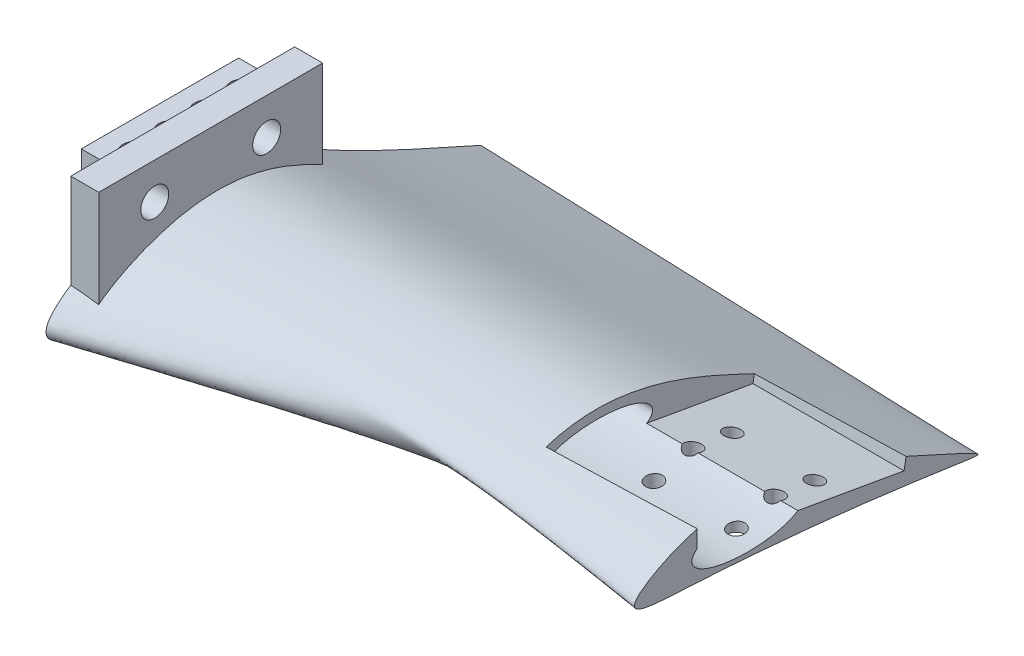
from build123d import *

# Parameters (mm, degrees)
SKIZZE5_R                            = 2.5
AUFSATZ_LINEAR_AUSTRAGEN1_DEPTH      = 5
LINEAR_AUSTRAGEN_D_NN1_START         = -5
LINEAR_AUSTRAGEN_D_NN1_OUTLINE_W     = 10
LINEAR_AUSTRAGEN_D_NN1_OUTLINE_H     = 28.115108073
LINEAR_AUSTRAGEN_D_NN1_DEPTH         = 5
SKIZZE11_R                           = 2
SCHNITT_LINEAR_AUSTRAGEN2_DEPTH      = 10
SCHNITT_LINEAR_AUSTRAGEN3_DEPTH      = 112.616851293
SCHNITT_LINEAR_AUSTRAGEN3_DEPTH_BACK = 9
SKIZZE13_W                           = 27
SKIZZE13_H                           = 37
SCHNITT_LINEAR_AUSTRAGEN7_DEPTH      = 110.939792027
SCHNITT_LINEAR_AUSTRAGEN7_DEPTH_BACK = 110.939792027
SKIZZE17_R                           = 1.5
SKIZZE18_RX                          = 10
SKIZZE18_RY                          = 3.5
SCHNITT_LINEAR_AUSTRAGEN8_DEPTH      = 130
SCHNITT_LINEAR_START                 = 10
SKIZZE19_W                           = 27
SKIZZE19_H                           = 37
SCHNITT_LINEAR_AUSTRAGEN9_DEPTH      = 10


with BuildPart() as part:
    # Ausformung2: read off the stored shape, not the designer's step
    # Ausformung2: loft between two sections, ruled curve by curve
    ausformung2_from = [
        Edge.make_bspline([(0, -17.782971384, -29.752553427), (0, -18.176213373, -31.916099097), (0, -18.569455363, -34.079644768), (0, -19.355939343, -38.406736108), (0, -19.749181333, -40.570281779), (0, -20.142423322, -42.733827449)], [0, 0, 0, 0, 0.5, 0.5, 1, 1, 1, 1], 3),
        Edge.make_bspline([(0, -20.142423322, -42.733827449), (0, -16.275365504, -34.022385206), (0, -12.283590924, -25.029989609), (0, -3.789748073, -8.991404596), (0, 2.066001276, 0.455761515), (0, 1.430346702, 14.415595101), (0, -0.586763944, 21.721696295), (0, -5.020157645, 31.4861646), (0, -10.795424952, 37.786454372), (0, -13.591275839, 30.846717822), (0, -14.496647802, 22.947187836), (0, -14.400669009, 16.385976946), (0, -13.749809382, 2.130524692), (0, -14.750138801, -12.525340255), (0, -16.988375852, -25.722839307), (0, -17.782971384, -29.752553427)], [0, 0, 0, 0, 0.191602301, 0.197781681, 0.372564125, 0.423341644, 0.45945546, 0.494491715, 0.570597143, 0.606711738, 0.621939361, 0.711658479, 0.750586032, 0.924326637, 1, 1, 1, 1], 3),
    ]
    ausformung2_to = [
        Edge.make_bspline([(100, -12.377537469, -31.541773649), (100, -12.377270286, -31.541839594), (100, -12.377002346, -31.541903238), (100, -12.37646495, -31.542025921), (100, -12.376195495, -31.542084959), (100, -12.375925281, -31.542141694)], [0, 0, 0, 0, 0.5, 0.5, 1, 1, 1, 1], 3),
        Edge.make_bspline([(100, -12.375925281, -31.542141694), (100, -12.035525318, -31.613612562), (100, -10.441454274, -27.913067425), (100, -1.381605701, -7.993573098), (100, 7.064474888, 11.469064179), (100, -4.778192252, 31.583106174), (100, -6.603305393, 28.459534197), (100, -7.058338771, 18.85555274), (100, -7.66482441, 10.032077024), (100, -8.265214542, 3.132625418), (100, -8.954299419, -4.117336517), (100, -9.69632267, -10.69452384), (100, -11.174529652, -22.235962019), (100, -12.331160065, -29.523287153), (100, -12.51047057, -31.508963631), (100, -12.377537469, -31.541773649)], [0, 0, 0, 0, 0.191602301, 0.197781681, 0.372564125, 0.423341644, 0.45945546, 0.494491715, 0.570597143, 0.606711738, 0.621939361, 0.711658479, 0.750586032, 0.924326637, 1, 1, 1, 1], 3),
    ]
    ausformung2 = Solid(Shell([*[Face.make_surface_from_curves(ausformung2_from[k], ausformung2_to[k]) for k in range(2)], Face(Wire(ausformung2_from)), Face(Wire(ausformung2_to))]))
    add(ausformung2)

    # Linear-Austragen-Dünn1: read off the stored shape, not the designer's step
    # Linear-Austragen-Dünn1 outline → Linear-Austragen-Dünn1 (add)
    with BuildSketch(Plane(origin=(0, 5, 0), x_dir=(1, 0, 0), z_dir=(0, 1, 0)).offset(LINEAR_AUSTRAGEN_D_NN1_START)):
        with Locations((-5, -4.594330562)):
            Rectangle(LINEAR_AUSTRAGEN_D_NN1_OUTLINE_W, LINEAR_AUSTRAGEN_D_NN1_OUTLINE_H)
    extrude(amount=LINEAR_AUSTRAGEN_D_NN1_DEPTH)

    # Skizze11 → Schnitt-Linear austragen2 (cut)
    with BuildSketch(Plane(origin=(0, 5, 0), x_dir=(1, 0, 0), z_dir=(0, 1, 0))):
        with Locations(Location((-5, -14.228862983, 0), (0, 0, 270))):
            Circle(SKIZZE11_R)
        with Locations(Location((-5, 5.040201861, 0), (0, 0, 270))):
            Circle(SKIZZE11_R)
        with Locations(Location((-5, -7.805841369, 0), (0, 0, 270))):
            Circle(SKIZZE11_R)
        with Locations(Location((-5, -1.382819754, 0), (0, 0, 270))):
            Circle(SKIZZE11_R)
    extrude(amount=-SCHNITT_LINEAR_AUSTRAGEN2_DEPTH, mode=Mode.SUBTRACT)

    # Skizze13 → Schnitt-Linear austragen3 (cut, two sides: drawn at the far end of the back side and taken through both)
    with BuildSketch(Plane(origin=(0, 5, 0), x_dir=(1, 0, 0), z_dir=(0, 1, 0)).offset(-SCHNITT_LINEAR_AUSTRAGEN3_DEPTH_BACK)):
        with Locations((86.5, -0.118029586)):
            Rectangle(SKIZZE13_W, SKIZZE13_H)
    extrude(amount=SCHNITT_LINEAR_AUSTRAGEN3_DEPTH + SCHNITT_LINEAR_AUSTRAGEN3_DEPTH_BACK, mode=Mode.SUBTRACT)

    # Skizze17 → Schnitt-Linear austragen7 (cut, two sides: drawn at the far end of the back side and taken through both)
    with BuildSketch(Plane(origin=(0, -4, 0), x_dir=(1, 0, 0), z_dir=(0, 1, 0)).offset(-SCHNITT_LINEAR_AUSTRAGEN7_DEPTH_BACK)):
        with Locations(Location((95.5, -7.118029586, 0), (0, 0, 270))):
            Circle(SKIZZE17_R)
        with Locations(Location((95.5, -0.118029586, 0), (0, 0, 270))):
            Circle(SKIZZE17_R)
        with Locations(Location((95.5, 6.881970414, 0), (0, 0, 270))):
            Circle(SKIZZE17_R)
        with Locations(Location((80.763664796, 6.881970414, 0), (0, 0, 270))):
            Circle(SKIZZE17_R)
        with Locations(Location((80.763664796, -0.118029586, 0), (0, 0, 270))):
            Circle(SKIZZE17_R)
        with Locations(Location((80.763664796, -7.118029586, 0), (0, 0, 270))):
            Circle(SKIZZE17_R)
    extrude(amount=SCHNITT_LINEAR_AUSTRAGEN7_DEPTH + SCHNITT_LINEAR_AUSTRAGEN7_DEPTH_BACK, mode=Mode.SUBTRACT)

    # Skizze18 → Schnitt-Linear austragen8 (cut)
    with BuildSketch(Plane.ZY):
        with Locations((9.606998582, -3.410935315)):
            Ellipse(SKIZZE18_RX, SKIZZE18_RY)
    extrude(amount=-SCHNITT_LINEAR_AUSTRAGEN8_DEPTH, mode=Mode.SUBTRACT)

    # Skizze19 → Schnitt-Linear austragen9 (cut)
    with BuildSketch(Plane(origin=(0, -4.924038765, 0.868240888), x_dir=(1, 0, 0), z_dir=(0, 0.984807753012208, -0.17364817766693072)).offset(SCHNITT_LINEAR_START)):
        with Locations((86.5, 1.001402317)):
            Rectangle(SKIZZE19_W, SKIZZE19_H)
    extrude(amount=-SCHNITT_LINEAR_AUSTRAGEN9_DEPTH, mode=Mode.SUBTRACT)


with BuildPart() as body_2:
    # Skizze5 → Aufsatz-Linear austragen1 (new body)
    with BuildSketch(Plane(origin=(0, 0, 0), x_dir=(0, 0, -1), z_dir=(1, 0, 0))):
        Polygon((9.463223475, -6.275842946), (9.463223475, 11.724157054), (-30.536776525, 11.724157054), (-30.536776525, -6.275842946), (-18.550921932, -0.442304191), (-3.818896749, -0.442304191), align=None)
        with Locations((-0.536776525, 5.224157054)):
            Circle(SKIZZE5_R, mode=Mode.SUBTRACT)
        with Locations((-20.536776525, 5.224157054)):
            Circle(SKIZZE5_R, mode=Mode.SUBTRACT)
    extrude(amount=AUFSATZ_LINEAR_AUSTRAGEN1_DEPTH)


solid = Compound([part.part, body_2.part])
